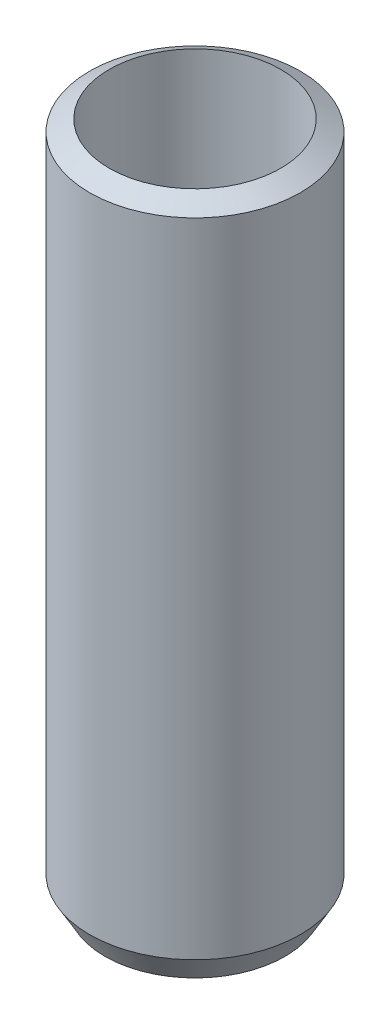
from build123d import *

# Parameters (mm, degrees)
SKETCH1_R           = 40
BOSS_EXTRUDE1_DEPTH = 259.874091
SKETCH2_R           = 32.554097406
CUT_EXTRUDE1_DEPTH  = 266.95966456
CHAMFER1_SIZE       = 5.826871
CHAMFER1_SIZE_2     = 10.092437


with BuildPart() as part:
    # Sketch1 → Boss-Extrude1 (new body)
    with BuildSketch(Plane(origin=(0, 0, 0), x_dir=(1, 0, 0), z_dir=(0, 1, 0))):
        with Locations(Location((0, 0, 0), (0, 0, 270))):
            Circle(SKETCH1_R)
    extrude(amount=BOSS_EXTRUDE1_DEPTH)

    # Sketch2 → Cut-Extrude1 (cut, through all)
    with BuildSketch(Plane(origin=(0, 0, 0), x_dir=(1, 0, 0), z_dir=(0, 1, 0))):
        with Locations(Location((0, 0, 0), (0, 0, 270))):
            Circle(SKETCH2_R)
    extrude(amount=CUT_EXTRUDE1_DEPTH, mode=Mode.SUBTRACT)

    # Chamfer1
    # the kernel refuses this chamfer: 10.092437, 5.826871 mm, written as the material it takes off along each edge
    with BuildSketch(Plane(origin=(0, 259.874091, 0), x_dir=(0, 0, 1), z_dir=(-1, 0, 0))) as chamfer1_piece_1:
        Polygon((40, -CHAMFER1_SIZE), (40 - CHAMFER1_SIZE_2, 0), (40, 0), align=None)
    revolve(axis=Axis((0, 259.874091, 0), (0, 1, 0)), mode=Mode.SUBTRACT)
    with BuildSketch(Plane(origin=(0, 0, 0), x_dir=(0, 0, 1), z_dir=(-1, 0, 0))) as chamfer1_piece_2:
        Polygon((40, CHAMFER1_SIZE_2), (40 - CHAMFER1_SIZE, 0), (40, 0), align=None)
    revolve(axis=Axis((0, 0, 0), (0, 1, 0)), mode=Mode.SUBTRACT)


solid = part.part
